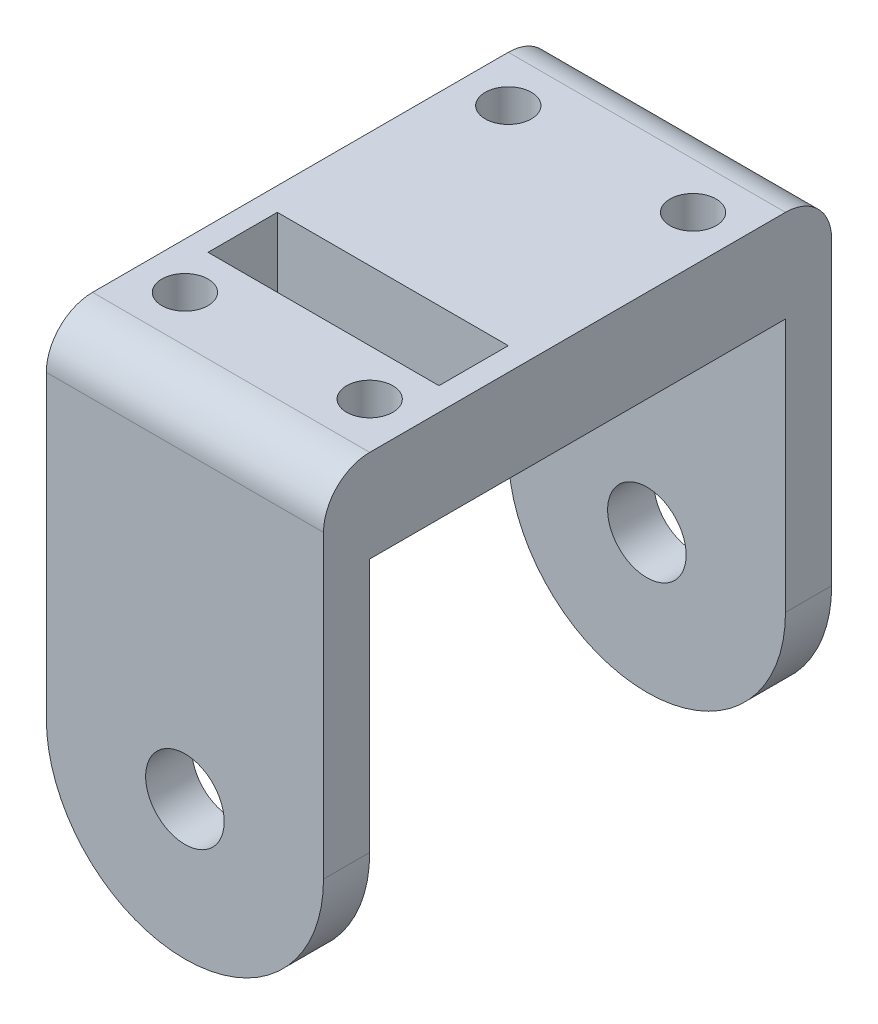
from build123d import *

# Parameters (mm, degrees)
SKETCH1_W           = 60
SKETCH1_H           = 90
BOSS_EXTRUDE1_DEPTH = 20
CUT_EXTRUDE1_DEPTH  = 10
BOSS_EXTRUDE2_DEPTH = 10
SKETCH5_R           = 8.5
CUT_EXTRUDE2_DEPTH  = 143.214626533
FILLET1_R           = 10
SKETCH6_W           = 50
SKETCH6_H           = 15
CUT_EXTRUDE3_DEPTH  = 123.270192606
FILLET2_R           = 5


with BuildPart() as part:
    # Sketch1 → Boss-Extrude1 (new body)
    with BuildSketch(Plane(origin=(0, 0, 0), x_dir=(1, 0, 0), z_dir=(0, 1, 0))):
        Rectangle(SKETCH1_W, SKETCH1_H)
    extrude(amount=BOSS_EXTRUDE1_DEPTH)

    # Sketch3 → Cut-Extrude1 (cut)
    with BuildSketch(Plane(origin=(0, 20, 0), x_dir=(1, 0, 0), z_dir=(0, 1, 0))):
        with BuildLine():
            ThreePointArc((-20, 30), (-16.464466094, 31.464466094), (-15, 35))
            Line((-15, 35), (-20, 35))
            Line((-20, 35), (-20, 30))
        make_face()
        with BuildLine():
            Line((-20, 35), (-15, 35))
            ThreePointArc((-15, 35), (-23.535533906, 38.535533906), (-20, 30))
            Line((-20, 30), (-20, 35))
        make_face()
        with BuildLine():
            ThreePointArc((-20, 30), (-16.464466094, 31.464466094), (-15, 35))
            Line((-15, 35), (-20, 35))
            Line((-20, 35), (-20, 30))
        make_face()
        with BuildLine():
            Line((-20, 35), (-15, 35))
            ThreePointArc((-15, 35), (-23.535533906, 38.535533906), (-20, 30))
            Line((-20, 30), (-20, 35))
        make_face()
        with BuildLine():
            ThreePointArc((-20, -30), (-23.535533906, -38.535533906), (-15, -35))
            Line((-15, -35), (-20, -35))
            Line((-20, -35), (-20, -30))
        make_face()
        with BuildLine():
            Line((-20, -35), (-15, -35))
            ThreePointArc((-15, -35), (-16.464466094, -31.464466094), (-20, -30))
            Line((-20, -30), (-20, -35))
        make_face()
        with BuildLine():
            ThreePointArc((-20, -30), (-23.535533906, -38.535533906), (-15, -35))
            Line((-15, -35), (-20, -35))
            Line((-20, -35), (-20, -30))
        make_face()
        with BuildLine():
            Line((-20, -35), (-15, -35))
            ThreePointArc((-15, -35), (-16.464466094, -31.464466094), (-20, -30))
            Line((-20, -30), (-20, -35))
        make_face()
        with BuildLine():
            Line((15, -35), (20, -35))
            Line((20, -35), (20, -30))
            ThreePointArc((20, -30), (16.464466094, -31.464466094), (15, -35))
        make_face()
        with BuildLine():
            Line((20, -30), (20, -35))
            Line((20, -35), (15, -35))
            ThreePointArc((15, -35), (20, -40), (25, -35))
            ThreePointArc((25, -35), (23.535533906, -31.464466094), (20, -30))
        make_face()
        with BuildLine():
            Line((15, -35), (20, -35))
            Line((20, -35), (20, -30))
            ThreePointArc((20, -30), (16.464466094, -31.464466094), (15, -35))
        make_face()
        with BuildLine():
            Line((20, -30), (20, -35))
            Line((20, -35), (15, -35))
            ThreePointArc((15, -35), (20, -40), (25, -35))
            ThreePointArc((25, -35), (23.535533906, -31.464466094), (20, -30))
        make_face()
        with BuildLine():
            ThreePointArc((15, 35), (16.464466094, 31.464466094), (20, 30))
            Line((20, 30), (20, 35))
            Line((20, 35), (15, 35))
        make_face()
        with BuildLine():
            Line((20, 35), (20, 30))
            ThreePointArc((20, 30), (23.535533906, 31.464466094), (25, 35))
            ThreePointArc((25, 35), (20, 40), (15, 35))
            Line((15, 35), (20, 35))
        make_face()
        with BuildLine():
            ThreePointArc((15, 35), (16.464466094, 31.464466094), (20, 30))
            Line((20, 30), (20, 35))
            Line((20, 35), (15, 35))
        make_face()
        with BuildLine():
            Line((20, 35), (20, 30))
            ThreePointArc((20, 30), (23.535533906, 31.464466094), (25, 35))
            ThreePointArc((25, 35), (20, 40), (15, 35))
            Line((15, 35), (20, 35))
        make_face()
    extrude(amount=-CUT_EXTRUDE1_DEPTH, mode=Mode.SUBTRACT)

    # Sketch4 → Boss-Extrude2 (add)
    with BuildSketch(Plane.XY.offset(45)):
        with BuildLine():
            Line((-30, 0), (-30, -55))
            ThreePointArc((-30, -55), (0, -85), (30, -55))
            Line((30, -55), (30, 0))
            Line((30, 0), (30, 20))
            Line((30, 20), (-30, 20))
            Line((-30, 20), (-30, 0))
        make_face()
    boss_extrude2 = extrude(amount=BOSS_EXTRUDE2_DEPTH)

    # Mirror1: Boss-Extrude2 across plane
    add(boss_extrude2.mirror(Plane.XY))

    # Sketch5 → Cut-Extrude2 (cut, through all)
    with BuildSketch(Plane.XY.offset(55)):
        with Locations((0, -55)):
            Circle(SKETCH5_R)
    extrude(amount=-CUT_EXTRUDE2_DEPTH, mode=Mode.SUBTRACT)

    # Fillet1
    fillet1_edges = [part.edges().sort_by_distance(p)[0] for p in [
        (0, 20, 55),
        (0, 20, -55),
    ]]
    fillet(fillet1_edges, radius=FILLET1_R)

    # Sketch6 → Cut-Extrude3 (cut, through all)
    with BuildSketch(Plane(origin=(0, 20, 0), x_dir=(1, 0, 0), z_dir=(0, 1, 0))):
        with Locations((0, -17.5)):
            Rectangle(SKETCH6_W, SKETCH6_H)
    extrude(amount=-CUT_EXTRUDE3_DEPTH, mode=Mode.SUBTRACT)

    # Fillet2
    fillet2_edges = [part.edges().sort_by_distance(p)[0] for p in [
        (-25, 0, 17.5),
        (25, 0, 17.5),
    ]]
    fillet(fillet2_edges, radius=FILLET2_R - 0.0001)  # a hair under: the kernel refuses the full size


solid = part.part
